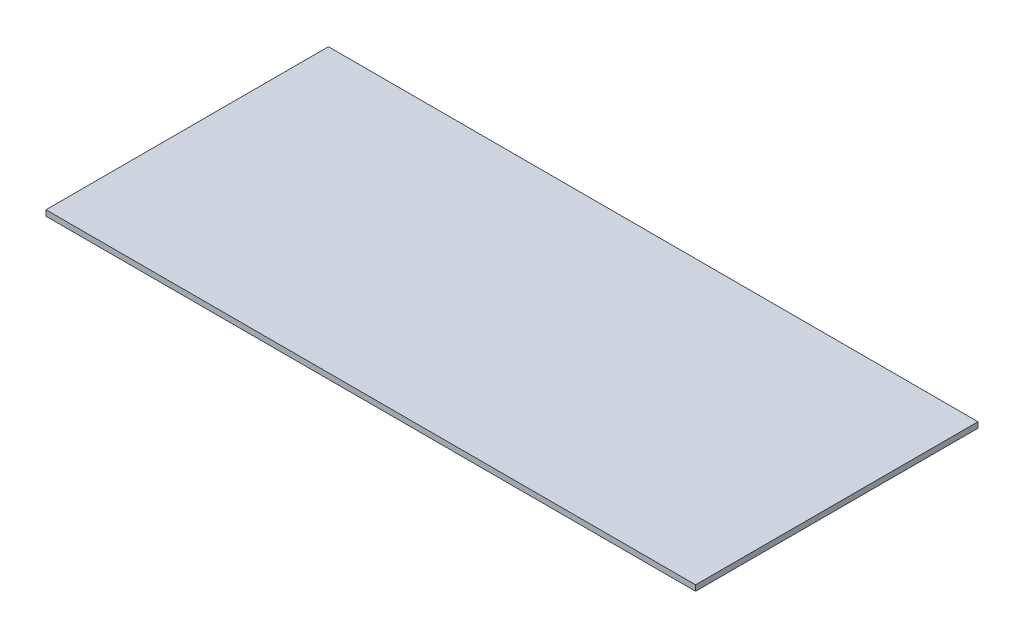
from build123d import *

# Parameters (mm, degrees)
SKETCH1_W           = 2300
SKETCH1_H           = 1000
BOSS_EXTRUDE1_DEPTH = 20


with BuildPart() as part:
    # Sketch1 → Boss-Extrude1 (new body)
    with BuildSketch(Plane(origin=(0, 0, 0), x_dir=(1, 0, 0), z_dir=(0, 1, 0))):
        with Locations((1150, 500)):
            Rectangle(SKETCH1_W, SKETCH1_H)
    extrude(amount=BOSS_EXTRUDE1_DEPTH)


solid = part.part
